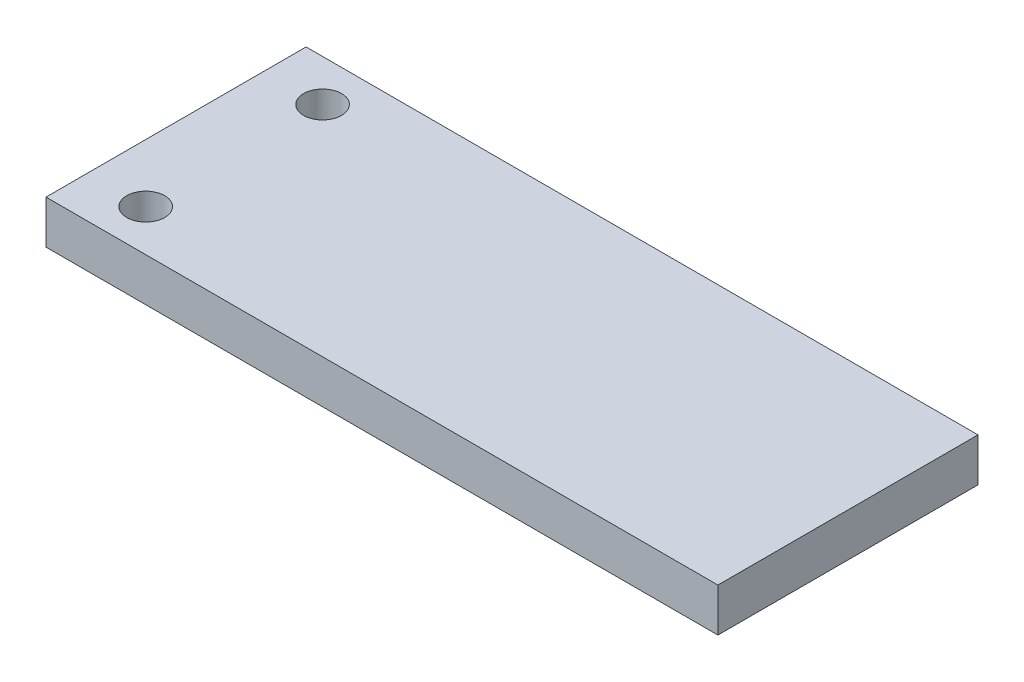
from build123d import *

# Parameters (mm, degrees)
SKETCH1_W           = 98.425
SKETCH1_H           = 38.1
BOSS_EXTRUDE1_DEPTH = 6.35
SKETCH2_R           = 2.778125
CUT_EXTRUDE1_DEPTH  = 106.732743864


with BuildPart() as part:
    # Sketch1 → Boss-Extrude1 (new body)
    with BuildSketch(Plane(origin=(0, 0, 0), x_dir=(1, 0, 0), z_dir=(0, 1, 0))):
        with Locations((49.2125, 19.05)):
            Rectangle(SKETCH1_W, SKETCH1_H)
    extrude(amount=BOSS_EXTRUDE1_DEPTH)

    # Sketch2 → Cut-Extrude1 (cut, through all)
    with BuildSketch(Plane.XZ):
        with Locations((8.509, -6.096)):
            Circle(SKETCH2_R)
        with Locations((8.509, -32.004)):
            Circle(SKETCH2_R)
    extrude(amount=-CUT_EXTRUDE1_DEPTH, mode=Mode.SUBTRACT)


solid = part.part
